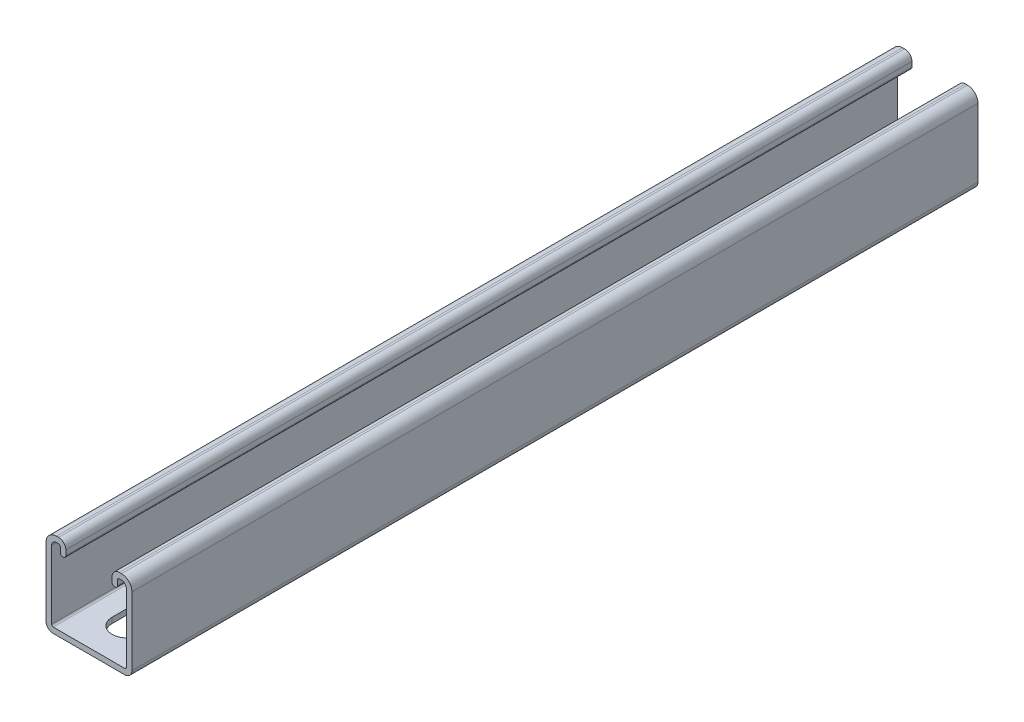
from build123d import *

# Parameters (mm, degrees)
PRIMARY_EXTRUSION_DEPTH = 406.4
SLOT_CUT_REACH          = 411.012
LPATTERN1_COUNT         = 8
LPATTERN1_PITCH         = 50.8


with BuildPart() as part:
    # Sketch1 → Primary Extrusion (new body)
    with BuildSketch(Plane.XY):
        with BuildLine():
            Line((17.176891111, -17.970376528), (-17.176891111, -17.970376528))
            ThreePointArc((-17.176891111, -17.970376528), (-17.738157147, -17.737892523), (-17.970641152, -17.176626487))
            Line((-17.970641152, -17.176626487), (-17.970641152, 15.589126408))
            ThreePointArc((-17.970641152, 15.589126408), (-17.273189139, 17.272924515), (-15.589391032, 17.970376528))
            Line((-15.589391032, 17.970376528), (-14.57342631, 17.970376528))
            ThreePointArc((-14.57342631, 17.970376528), (-14.012171972, 17.737897369), (-13.779692813, 17.176643031))
            Line((-13.779692813, 17.176643031), (-13.779692813, 14.833457753))
            ThreePointArc((-13.779692813, 14.833457753), (-12.446175174, 13.499940114), (-11.112657535, 14.833457753))
            Line((-11.112657535, 14.833457753), (-11.112657535, 17.176643031))
            ThreePointArc((-11.112657535, 17.176643031), (-12.126293241, 19.623776099), (-14.57342631, 20.637411806))
            Line((-14.57342631, 20.637411806), (-15.589391032, 20.637411806))
            ThreePointArc((-15.589391032, 20.637411806), (-19.15906787, 19.158803246), (-20.637676429, 15.589126408))
            Line((-20.637676429, 15.589126408), (-20.637676429, -17.176626487))
            ThreePointArc((-20.637676429, -17.176626487), (-19.624035878, -19.623771254), (-17.176891111, -20.637411806))
            Line((-17.176891111, -20.637411806), (17.176891111, -20.637411806))
            ThreePointArc((17.176891111, -20.637411806), (19.624035878, -19.623771254), (20.637676429, -17.176626487))
            Line((20.637676429, -17.176626487), (20.637676429, 15.589126408))
            ThreePointArc((20.637676429, 15.589126408), (19.15906787, 19.158803246), (15.589391032, 20.637411806))
            Line((15.589391032, 20.637411806), (14.57342631, 20.637411806))
            ThreePointArc((14.57342631, 20.637411806), (12.126293241, 19.623776099), (11.112657535, 17.176643031))
            Line((11.112657535, 17.176643031), (11.112657535, 14.833457753))
            ThreePointArc((11.112657535, 14.833457753), (12.446175174, 13.499940114), (13.779692813, 14.833457753))
            Line((13.779692813, 14.833457753), (13.779692813, 17.176643031))
            ThreePointArc((13.779692813, 17.176643031), (14.012171972, 17.737897369), (14.57342631, 17.970376528))
            Line((14.57342631, 17.970376528), (15.589391032, 17.970376528))
            ThreePointArc((15.589391032, 17.970376528), (17.273189139, 17.272924515), (17.970641152, 15.589126408))
            Line((17.970641152, 15.589126408), (17.970641152, -17.176626487))
            ThreePointArc((17.970641152, -17.176626487), (17.738157147, -17.737892523), (17.176891111, -17.970376528))
        make_face()
    extrude(amount=-PRIMARY_EXTRUSION_DEPTH)

    # Sketch58 → Slot Cut (cut, up to next)
    with BuildSketch(Plane(origin=(0, -20.637411806, 0), x_dir=(-1, 0, 0), z_dir=(0, 1, 0)), mode=Mode.PRIVATE) as slot_cut_sk1:
        with BuildLine():
            Line((7.14375, -32.54375), (7.14375, -18.25625))
            ThreePointArc((7.14375, -18.25625), (0, -11.1125), (-7.14375, -18.25625))
            Line((-7.14375, -18.25625), (-7.14375, -32.54375))
            ThreePointArc((-7.14375, -32.54375), (0, -39.6875), (7.14375, -32.54375))
        make_face()
    slot_cut_tool1 = extrude(slot_cut_sk1.sketch, amount=SLOT_CUT_REACH, mode=Mode.PRIVATE) & part.part
    slot_cut = slot_cut_tool1.solids().sort_by_distance((0, -20.637412, -25.4))[0]
    add(slot_cut, mode=Mode.SUBTRACT)

    # LPattern1: Slot Cut ×8
    with Locations(*[(0, 0, -i * LPATTERN1_PITCH) for i in range(1, LPATTERN1_COUNT)]):
        add(slot_cut, mode=Mode.SUBTRACT)


solid = part.part
